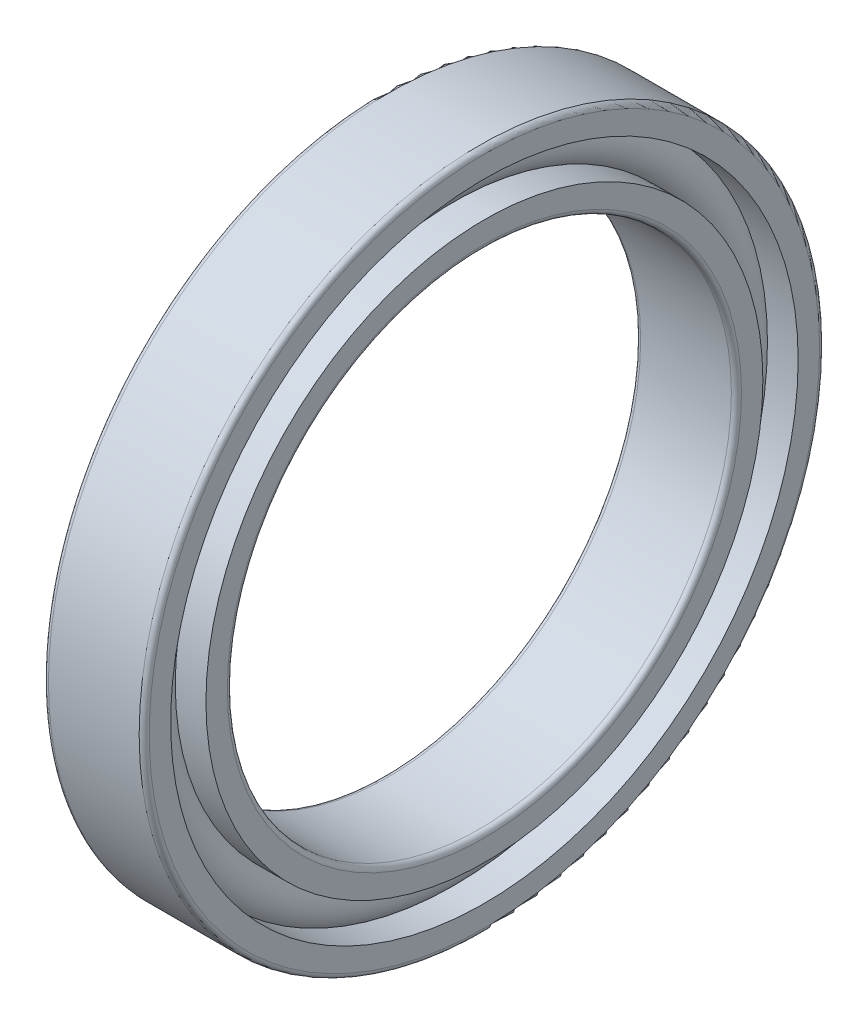
from build123d import *

# Parameters (mm, degrees)
CAGSPISKE_W     = 0.21
CAGSPISKE_H     = 0.35
CAGESPINE_ANGLE = 0.001
BALSIMSKE_R     = 1.05


with BuildPart() as part:
    # CagSpiSke → CageSpine (revolve)
    with BuildSketch(Plane.XY):
        with Locations((0, 11.75)):
            Rectangle(CAGSPISKE_W, CAGSPISKE_H)
    revolve(axis=Axis((-20.6375, 0, 0), (-1, 0, 0)), revolution_arc=CAGESPINE_ANGLE)

    # BalSimSke → BallsSimplified (revolve)
    with BuildSketch(Plane.XY):
        with Locations((0, 11.75)):
            Circle(BALSIMSKE_R)
    revolve(axis=Axis((-10, 0, 0), (1, 0, 0)))

    # InnRacSke → InnerRace (revolve)
    with BuildSketch(Plane.XY):
        with BuildLine():
            Line((-0.748748957, 11.05), (-2, 11.05))
            Line((-2, 11.05), (-2, 10.2))
            ThreePointArc((-2, 10.2), (-1.941421356, 10.058578644), (-1.8, 10))
            Line((-1.8, 10), (1.8, 10))
            ThreePointArc((1.8, 10), (1.941421356, 10.058578644), (2, 10.2))
            Line((2, 10.2), (2, 11.05))
            Line((2, 11.05), (0.748748957, 11.05))
            ThreePointArc((0.748748957, 11.05), (0, 10.725), (-0.748748957, 11.05))
        make_face()
    revolve(axis=Axis((-20.6375, 0, 0), (1, 0, 0)))

    # OutRacSke → OuterRace (revolve)
    with BuildSketch(Plane.XY):
        with BuildLine():
            Line((-0.748748957, 12.45), (-2, 12.45))
            Line((-2, 12.45), (-2, 13.3))
            ThreePointArc((-2, 13.3), (-1.941421356, 13.441421356), (-1.8, 13.5))
            Line((-1.8, 13.5), (1.8, 13.5))
            ThreePointArc((1.8, 13.5), (1.941421356, 13.441421356), (2, 13.3))
            Line((2, 13.3), (2, 12.45))
            Line((2, 12.45), (0.748748957, 12.45))
            ThreePointArc((0.748748957, 12.45), (0, 12.775), (-0.748748957, 12.45))
        make_face()
    revolve(axis=Axis((-20.6375, 0, 0), (1, 0, 0)))


solid = part.part
